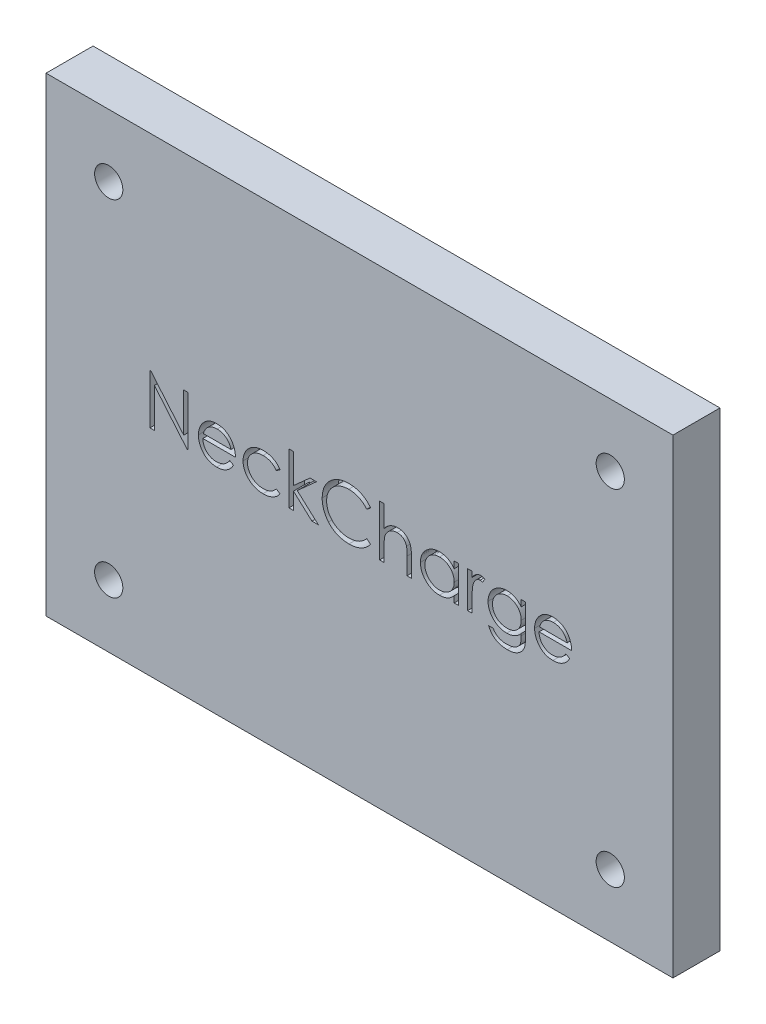
from build123d import *

# Parameters (mm, degrees)
SKETCH1_W           = 40
SKETCH1_H           = 30
SKETCH1_W_2         = 36
SKETCH1_H_2         = 26
EXTRUDE_THIN1_DEPTH = 1
SKETCH1_3_W         = 40
SKETCH1_3_H         = 30
SKETCH1_3_W_2       = 36
SKETCH1_3_H_2       = 26
BOSS_EXTRUDE1_DEPTH = 2
SKETCH2_R           = 0.9
CUT_EXTRUDE1_DEPTH  = 2
WRAP1_START         = -1
WRAP1_DEPTH         = 1


# Read off the part's stored shape, not the designer's step: Wrap1
with BuildPart() as part:
    # Sketch1 → Extrude-Thin1 (new body)
    # profile 1 of 2: a face of its own
    with BuildSketch(Plane.XY):
        with Locations((1.25, 0)):
            Rectangle(SKETCH1_W, SKETCH1_H)
        with Locations((1.25, 0)):
            Rectangle(SKETCH1_W_2, SKETCH1_H_2, mode=Mode.SUBTRACT)
    # profile 2 of 2: a face of its own
    with BuildSketch(Plane.XY):
        with Locations((1.25, 0)):
            Rectangle(SKETCH1_W, SKETCH1_H)
        with Locations((1.25, 0)):
            Rectangle(SKETCH1_W_2, SKETCH1_H_2, mode=Mode.SUBTRACT)
    extrude(amount=-EXTRUDE_THIN1_DEPTH)

    # Sketch1<3> → Boss-Extrude1 (add)
    # profile 1 of 2: a face of its own
    with BuildSketch(Plane.XY):
        with Locations((1.25, 0)):
            Rectangle(SKETCH1_3_W, SKETCH1_3_H)
        with Locations((1.25, 0)):
            Rectangle(SKETCH1_3_W_2, SKETCH1_3_H_2, mode=Mode.SUBTRACT)
    # profile 2 of 2: a face of its own
    with BuildSketch(Plane.XY):
        with Locations((1.25, 0)):
            Rectangle(SKETCH1_3_W_2, SKETCH1_3_H_2)
    extrude(amount=BOSS_EXTRUDE1_DEPTH)

    # Sketch2 → Cut-Extrude1 (cut)
    with BuildSketch(Plane(origin=(0, 0, 0), x_dir=(-1, 0, 0), z_dir=(0, 0, -1))):
        with Locations((-17.25, 11)):
            Circle(SKETCH2_R)
        with Locations((14.75, 11)):
            Circle(SKETCH2_R)
        with Locations((14.75, -11)):
            Circle(SKETCH2_R)
        with Locations((-17.25, -11)):
            Circle(SKETCH2_R)
    extrude(amount=-CUT_EXTRUDE1_DEPTH, mode=Mode.SUBTRACT)

    # Wrap1 outline → Wrap1 (cut)
    # profile 1 of 10: a face of its own
    with BuildSketch(Plane.XY.offset(2).offset(WRAP1_START)):
        with BuildLine():
            add(Edge.make_bspline(
                [(14.662320676, -0.641993919), (14.642148907, -0.677774655), (14.602902634, -0.747389798), (14.535410527, -0.843031557), (14.464660575, -0.929071985), (14.387459119, -1.003212457), (14.30611591, -1.067847642), (14.220179859, -1.124396955), (14.129203574, -1.172583041), (14.033182752, -1.213179977), (13.931311017, -1.244394304), (13.823341498, -1.266441704), (13.709067356, -1.280069955), (13.630739036, -1.281653047), (13.590630972, -1.28246367)],
                knots=[0, 0, 0, 0, 0.093369857, 0.181660766, 0.265874227, 0.346354784, 0.424599862, 0.501903184, 0.579992091, 0.658443431, 0.738672236, 0.821894148, 0.908800792, 1, 1, 1, 1], degree=3))
            Line((14.662320676, -0.641993919), (14.40918566, -0.509066234))
            add(Edge.make_bspline(
                [(13.555013985, -0.997527773), (13.583453955, -0.996976179), (13.63988431, -0.99588171), (13.723922802, -0.985239191), (13.806599373, -0.968030441), (13.887571837, -0.944544521), (13.965196818, -0.915899805), (14.037083853, -0.88133507), (14.10319662, -0.843099228), (14.16498844, -0.799366166), (14.224924269, -0.745837311), (14.284380668, -0.679039192), (14.348131632, -0.600038363), (14.388036477, -0.540579081), (14.40918566, -0.509066234)],
                knots=[0, 0, 0, 0, 0.082592263, 0.163878894, 0.24565874, 0.327725695, 0.408609961, 0.485749086, 0.559169056, 0.630268476, 0.705306028, 0.792064966, 0.889796437, 1, 1, 1, 1], degree=3))
            add(Edge.make_bspline(
                [(12.708474522, -0.142720081), (12.709871165, -0.173291216), (12.712617607, -0.233408121), (12.725422058, -0.321374474), (12.745604874, -0.405170292), (12.773970381, -0.484167051), (12.80832102, -0.559396524), (12.850399491, -0.630300657), (12.900600372, -0.696556494), (12.9565944, -0.758756683), (13.01892155, -0.814147516), (13.084492328, -0.863724485), (13.154245776, -0.905276705), (13.227631895, -0.939004176), (13.304532014, -0.965407763), (13.384970363, -0.983430714), (13.468788654, -0.995502161), (13.525925713, -0.996844429), (13.555013985, -0.997527773)],
                knots=[0, 0, 0, 0, 0.068384615, 0.134475588, 0.198391058, 0.260753477, 0.321829223, 0.383037238, 0.444653123, 0.507398011, 0.569825238, 0.630777641, 0.690928687, 0.750945133, 0.811049477, 0.872330853, 0.935004094, 1, 1, 1, 1], degree=3))
            Line((12.708474522, -0.142720081), (14.78443606, -0.142720081))
            add(Edge.make_bspline(
                [(14.531937062, 0.662478237), (14.552009356, 0.635079274), (14.592020337, 0.580463723), (14.642137349, 0.491408459), (14.685641557, 0.398235277), (14.720415029, 0.299438079), (14.748572291, 0.19618746), (14.768943834, 0.087745294), (14.780890559, -0.025856125), (14.783238877, -0.103259501), (14.78443606, -0.142720081)],
                knots=[0, 0, 0, 0, 0.11852184, 0.236254763, 0.356174434, 0.477249655, 0.601539871, 0.729618382, 0.862158266, 1, 1, 1, 1], degree=3))
            add(Edge.make_bspline(
                [(13.597627166, 1.119138894), (13.645204637, 1.117910578), (13.738540788, 1.115500903), (13.874641355, 1.0931613), (14.003420005, 1.057735054), (14.124825206, 1.007702687), (14.238869265, 0.943150808), (14.344810896, 0.863193566), (14.444461911, 0.77028573), (14.502436121, 0.698836247), (14.531937062, 0.662478237)],
                knots=[0, 0, 0, 0, 0.132040234, 0.259032841, 0.381879824, 0.502258444, 0.62275219, 0.744742632, 0.870108927, 1, 1, 1, 1], degree=3))
            add(Edge.make_bspline(
                [(12.690666028, 0.686646907), (12.719429426, 0.720999382), (12.776045071, 0.788616132), (12.871799764, 0.877460185), (12.975486371, 0.95188561), (13.085805489, 1.013577798), (13.204039291, 1.060453177), (13.328598433, 1.095385055), (13.460901215, 1.114959394), (13.551348094, 1.117724215), (13.597627166, 1.119138894)],
                knots=[0, 0, 0, 0, 0.128835254, 0.253589335, 0.374643257, 0.495340042, 0.616324775, 0.739759335, 0.86684232, 1, 1, 1, 1], degree=3))
            add(Edge.make_bspline(
                [(12.423538624, -0.088022564), (12.424499417, -0.05237654), (12.426403581, 0.018269174), (12.438405795, 0.122831489), (12.459676747, 0.2244573), (12.488865269, 0.323231049), (12.526558185, 0.418987356), (12.57267027, 0.5117845), (12.627273355, 0.601523734), (12.669430709, 0.658132291), (12.690666028, 0.686646907)],
                knots=[0, 0, 0, 0, 0.128044808, 0.2537679, 0.377428427, 0.500550841, 0.623295883, 0.746578332, 0.872347541, 1, 1, 1, 1], degree=3))
            add(Edge.make_bspline(
                [(13.590630972, -1.28246367), (13.546052178, -1.281423018), (13.459091866, -1.279393008), (13.332509381, -1.261891987), (13.21332948, -1.233342061), (13.101558864, -1.193459034), (12.997471249, -1.141364247), (12.900859759, -1.077901003), (12.811216332, -1.003395315), (12.731365799, -0.917201827), (12.659480277, -0.824961766), (12.596047569, -0.728844642), (12.543018328, -0.629092288), (12.499881317, -0.526339742), (12.465042618, -0.421234638), (12.440761394, -0.312820664), (12.426764409, -0.201391241), (12.424619519, -0.126010087), (12.423538624, -0.088022564)],
                knots=[0, 0, 0, 0, 0.071578658, 0.139629225, 0.204796697, 0.268134963, 0.329813747, 0.391301398, 0.453433515, 0.51655169, 0.579631271, 0.641118921, 0.701294047, 0.760810336, 0.819931722, 0.878919575, 0.938982822, 1, 1, 1, 1], degree=3))
        make_face()
        with BuildLine():
            add(Edge.make_bspline(
                [(13.612255572, 0.834202996), (13.583817152, 0.833648123), (13.527600376, 0.832551255), (13.444777265, 0.822146209), (13.365239252, 0.804946921), (13.288399455, 0.781392996), (13.215264811, 0.74999805), (13.144330985, 0.713183265), (13.077401626, 0.668241972), (13.035544879, 0.633989296), (13.014399001, 0.616684968)],
                knots=[0, 0, 0, 0, 0.131091976, 0.259141276, 0.384161763, 0.505991952, 0.629098089, 0.750669123, 0.874038938, 1, 1, 1, 1], degree=3))
            add(Edge.make_bspline(
                [(14.499500163, 0.142215817), (14.489071082, 0.180009995), (14.468998459, 0.252751622), (14.427055471, 0.353481573), (14.379819145, 0.443005598), (14.323919431, 0.52063855), (14.260583873, 0.589584594), (14.187427172, 0.649835739), (14.105388897, 0.703735856), (14.014893105, 0.749231337), (13.919060914, 0.787957138), (13.818725297, 0.813924207), (13.716347161, 0.831712863), (13.647101058, 0.833369405), (13.612255572, 0.834202996)],
                knots=[0, 0, 0, 0, 0.096240125, 0.185231261, 0.267500523, 0.344400382, 0.419594869, 0.496890627, 0.576637919, 0.660267852, 0.745386615, 0.830040327, 0.914474212, 1, 1, 1, 1], degree=3))
            Line((14.499500163, 0.142215817), (12.73836735, 0.142215817))
            add(Edge.make_bspline(
                [(13.014399001, 0.616684968), (12.99925581, 0.602992267), (12.968609681, 0.575281578), (12.927660779, 0.527539369), (12.888453636, 0.476057595), (12.852772394, 0.418866661), (12.820044869, 0.356617811), (12.789419747, 0.289836099), (12.76185493, 0.21801476), (12.746346316, 0.167965475), (12.73836735, 0.142215817)],
                knots=[0, 0, 0, 0, 0.109983845, 0.222580497, 0.338499871, 0.458708565, 0.585535346, 0.717517743, 0.85466682, 1, 1, 1, 1], degree=3))
        make_face(mode=Mode.SUBTRACT)
    # profile 2 of 10: a face of its own
    with BuildSketch(Plane.XY.offset(2).offset(WRAP1_START)):
        with BuildLine():
            add(Edge.make_bspline(
                [(11.853672014, -0.768387875), (11.853420697, -0.807610551), (11.852935594, -0.883319761), (11.849442213, -0.992792201), (11.842075598, -1.093907864), (11.833722009, -1.187127913), (11.821705345, -1.272020256), (11.807031069, -1.348838206), (11.790488703, -1.41765548), (11.775956077, -1.460041586), (11.769081669, -1.480091601)],
                knots=[0, 0, 0, 0, 0.163445255, 0.315488713, 0.456290824, 0.58586415, 0.705428686, 0.813370713, 0.911718238, 1, 1, 1, 1], degree=3))
            Line((11.853672014, -0.768387875), (11.853672014, 1.072883158))
            Line((11.853672014, 1.072883158), (11.568736116, 1.072883158))
            Line((11.568736116, 1.072883158), (11.568736116, 0.667103911))
            add(Edge.make_bspline(
                [(10.650326661, 1.113588286), (10.693008584, 1.11235759), (10.777292268, 1.109927343), (10.90132682, 1.090858161), (11.021017281, 1.060456163), (11.137039052, 1.016899127), (11.25033725, 0.957435878), (11.360538466, 0.879110489), (11.467961538, 0.781220395), (11.53425357, 0.706151725), (11.568736116, 0.667103911)],
                knots=[0, 0, 0, 0, 0.120911079, 0.238762229, 0.354754859, 0.470359399, 0.589144099, 0.716328905, 0.852445286, 1, 1, 1, 1], degree=3))
            add(Edge.make_bspline(
                [(9.45206945, -0.079580784), (9.452540408, -0.053270833), (9.4534805, -0.000752832), (9.461600317, 0.077152039), (9.473182888, 0.154013741), (9.491514222, 0.229040026), (9.513578224, 0.303085337), (9.540904608, 0.375602751), (9.573760197, 0.446614356), (9.610961898, 0.516172738), (9.652766754, 0.583344503), (9.698606933, 0.647140817), (9.748537776, 0.70709223), (9.801870442, 0.763803556), (9.859256133, 0.816727625), (9.920665162, 0.865735986), (9.985492203, 0.911650138), (10.053938173, 0.953479708), (10.124946947, 0.990475032), (10.196714482, 1.024232173), (10.270191452, 1.051023839), (10.34400797, 1.074630507), (10.419464035, 1.091353863), (10.495634457, 1.104255468), (10.572780006, 1.112115608), (10.624444418, 1.11309676), (10.650326661, 1.113588286)],
                knots=[0, 0, 0, 0, 0.042034119, 0.083905433, 0.125068934, 0.16615847, 0.207210273, 0.248490732, 0.289878112, 0.332169514, 0.374475842, 0.41622498, 0.457609587, 0.49907317, 0.540553362, 0.582248849, 0.62454975, 0.667432801, 0.710322543, 0.752467119, 0.794064757, 0.835215707, 0.876228344, 0.917446189, 0.95864314, 1, 1, 1, 1], degree=3))
            add(Edge.make_bspline(
                [(10.641422414, -1.247309149), (10.614900941, -1.246841947), (10.56217185, -1.245913071), (10.483835758, -1.23778618), (10.406655646, -1.225994463), (10.330811515, -1.208684872), (10.256193923, -1.186467378), (10.182926179, -1.158693622), (10.110415051, -1.127292764), (10.039978585, -1.090306007), (9.972318309, -1.049155914), (9.907944563, -1.004579921), (9.847194531, -0.956811331), (9.79064643, -0.905379107), (9.738374435, -0.850357688), (9.689675498, -0.792333607), (9.645354904, -0.730496635), (9.604503187, -0.665974323), (9.569072409, -0.598336914), (9.537971586, -0.52905107), (9.510930197, -0.45826494), (9.489371583, -0.385741533), (9.47290593, -0.311526571), (9.460650224, -0.235741636), (9.45369885, -0.158153355), (9.452614883, -0.10588256), (9.45206945, -0.079580784)],
                knots=[0, 0, 0, 0, 0.042864759, 0.085222258, 0.127202284, 0.169025313, 0.210882033, 0.252962678, 0.295628285, 0.338553294, 0.381463248, 0.423581562, 0.465066165, 0.506312219, 0.547039505, 0.587675833, 0.628674786, 0.669946465, 0.711035574, 0.751995829, 0.792672607, 0.833446018, 0.874190607, 0.915493583, 0.957477807, 1, 1, 1, 1], degree=3))
            add(Edge.make_bspline(
                [(11.568736116, -0.802732827), (11.539815388, -0.837151462), (11.482482639, -0.905383319), (11.383470421, -0.994792803), (11.275323648, -1.07179665), (11.158226434, -1.134950697), (11.0350471, -1.185461704), (10.907119791, -1.220788532), (10.775591284, -1.243612156), (10.686462548, -1.246068079), (10.641422414, -1.247309149)],
                knots=[0, 0, 0, 0, 0.126560713, 0.250895262, 0.374719265, 0.499826424, 0.624963531, 0.749039475, 0.87318012, 1, 1, 1, 1], degree=3))
            Line((11.568736116, -0.802732827), (11.568736116, -0.922940159))
            add(Edge.make_bspline(
                [(10.650326661, -1.857886073), (10.700008055, -1.856588723), (10.795788808, -1.854087564), (10.933521369, -1.833729333), (11.059246777, -1.799644861), (11.172240673, -1.751921539), (11.271169835, -1.693455813), (11.356452141, -1.62814146), (11.42552624, -1.554498693), (11.471983717, -1.486660912), (11.500862263, -1.426223308), (11.519252078, -1.374196311), (11.534196321, -1.315365486), (11.546696603, -1.249928068), (11.557011645, -1.177790565), (11.563545689, -1.098788035), (11.568268103, -1.013100026), (11.568576505, -0.953688393), (11.568736116, -0.922940159)],
                knots=[0, 0, 0, 0, 0.098171298, 0.189264436, 0.274463056, 0.355023171, 0.430920462, 0.501086045, 0.566607627, 0.629720863, 0.662710695, 0.698765562, 0.738610537, 0.782581228, 0.830408787, 0.882577866, 0.939228681, 1, 1, 1, 1], degree=3))
            add(Edge.make_bspline(
                [(9.777710475, -1.410129662), (9.800626908, -1.446511421), (9.845425712, -1.517633279), (9.929198977, -1.609720214), (10.021007573, -1.688417909), (10.123949857, -1.751836968), (10.23845416, -1.799652279), (10.364589368, -1.833738441), (10.503381882, -1.854145768), (10.600009119, -1.856605299), (10.650326661, -1.857886073)],
                knots=[0, 0, 0, 0, 0.124716487, 0.243805374, 0.360061534, 0.475112, 0.593525098, 0.71935017, 0.853854771, 1, 1, 1, 1], degree=3))
            Line((9.777710475, -1.410129662), (9.492774578, -1.410129662))
            add(Edge.make_bspline(
                [(10.677675419, -2.14282197), (10.62970141, -2.142045015), (10.535995281, -2.140527413), (10.399375037, -2.122846369), (10.269622113, -2.097850616), (10.148450999, -2.060017835), (10.036627411, -2.013719995), (9.934915038, -1.960566002), (9.844226962, -1.8996157), (9.762471916, -1.830218726), (9.688683473, -1.747701672), (9.619262289, -1.650457006), (9.552441291, -1.537003471), (9.51328117, -1.453734367), (9.492774578, -1.410129662)],
                knots=[0, 0, 0, 0, 0.096491424, 0.188473675, 0.276839915, 0.362136562, 0.443436755, 0.520165521, 0.592709664, 0.662917334, 0.7354188, 0.81488097, 0.903060556, 1, 1, 1, 1], degree=3))
            add(Edge.make_bspline(
                [(11.769081669, -1.480091601), (11.758931431, -1.506153745), (11.738934441, -1.55749879), (11.701482473, -1.630282781), (11.659541718, -1.698814149), (11.611638451, -1.762710979), (11.557989293, -1.821652507), (11.499858225, -1.876919278), (11.436113123, -1.927342058), (11.366790434, -1.972050864), (11.293488181, -2.012316263), (11.216248503, -2.047192792), (11.135506948, -2.077570143), (11.050505039, -2.100323822), (10.96257547, -2.120040318), (10.870684229, -2.132871569), (10.775368191, -2.141604686), (10.710557025, -2.142412254), (10.677675419, -2.14282197)],
                knots=[0, 0, 0, 0, 0.061370706, 0.120906468, 0.179423665, 0.237606687, 0.295938468, 0.354218227, 0.413537067, 0.474086783, 0.535121189, 0.596987665, 0.660019834, 0.724277496, 0.79001185, 0.857747684, 0.927829032, 1, 1, 1, 1], degree=3))
        make_face()
        with BuildLine():
            add(Edge.make_bspline(
                [(9.737005347, -0.091029101), (9.737663712, -0.121811427), (9.738958524, -0.18235126), (9.751407769, -0.271194922), (9.771529074, -0.355813492), (9.800047111, -0.436212089), (9.83538277, -0.512851867), (9.879825849, -0.585204887), (9.932123516, -0.653335585), (9.991866437, -0.716740046), (10.057703583, -0.774489639), (10.129113143, -0.825233433), (10.205998262, -0.866735873), (10.286468011, -0.902605061), (10.372474912, -0.928802501), (10.462780154, -0.948794822), (10.558022621, -0.960232767), (10.622948413, -0.961650448), (10.65605082, -0.962373252)],
                knots=[0, 0, 0, 0, 0.064983044, 0.127802645, 0.189056336, 0.248394647, 0.307690706, 0.366976619, 0.427340044, 0.488794715, 0.550673693, 0.612045111, 0.673369139, 0.734929754, 0.797809968, 0.862891673, 0.930095338, 1, 1, 1, 1], degree=3))
            add(Edge.make_bspline(
                [(10.673223296, 0.828652389), (10.631557586, 0.82723628), (10.549068315, 0.824432683), (10.428156747, 0.800497979), (10.311428386, 0.762991341), (10.201114891, 0.70934054), (10.09778487, 0.643940767), (10.006095568, 0.564710649), (9.92589968, 0.474226599), (9.858060872, 0.373306732), (9.804057418, 0.264429382), (9.765827316, 0.149666073), (9.741107652, 0.030871187), (9.738379282, -0.050202531), (9.737005347, -0.091029101)],
                knots=[0, 0, 0, 0, 0.085518899, 0.169309287, 0.252217903, 0.336756454, 0.420595494, 0.502741104, 0.584803551, 0.668268485, 0.75182313, 0.833628628, 0.916219799, 1, 1, 1, 1], degree=3))
            add(Edge.make_bspline(
                [(11.568736116, -0.074492643), (11.567520937, -0.03220359), (11.565146903, 0.05041436), (11.542743052, 0.170798356), (11.506620433, 0.283981368), (11.455959451, 0.389605431), (11.392475771, 0.48655138), (11.31601193, 0.573023725), (11.227886602, 0.649133787), (11.128352983, 0.712541434), (11.021267086, 0.76376365), (10.909215715, 0.802191829), (10.792365225, 0.8239581), (10.713165839, 0.82707862), (10.673223296, 0.828652389)],
                knots=[0, 0, 0, 0, 0.089242793, 0.174349058, 0.257613109, 0.339527367, 0.42099739, 0.501579059, 0.58254176, 0.666132658, 0.750049131, 0.83274294, 0.915647421, 1, 1, 1, 1], degree=3))
            add(Edge.make_bspline(
                [(10.65605082, -0.962373252), (10.689582229, -0.961676921), (10.755152545, -0.960315253), (10.850920465, -0.948609936), (10.941664451, -0.929721429), (11.027301297, -0.902903542), (11.108154342, -0.868684525), (11.183315314, -0.825380594), (11.254395806, -0.776064288), (11.319126264, -0.718540532), (11.3776589, -0.655144858), (11.428668238, -0.586161275), (11.472133488, -0.512627804), (11.508126803, -0.434552734), (11.535605253, -0.351329314), (11.554037402, -0.263165591), (11.566924949, -0.17048395), (11.568123217, -0.106976133), (11.568736116, -0.074492643)],
                knots=[0, 0, 0, 0, 0.070121499, 0.137121849, 0.201487121, 0.263765119, 0.324560095, 0.384738887, 0.444904604, 0.50523192, 0.565493995, 0.625099744, 0.684349714, 0.743882825, 0.804608206, 0.867238914, 0.932094288, 1, 1, 1, 1], degree=3))
        make_face(mode=Mode.SUBTRACT)
    # profile 3 of 10: a face of its own
    with BuildSketch(Plane.XY.offset(2).offset(WRAP1_START)):
        with BuildLine():
            add(Edge.make_bspline(
                [(8.434443517, 0.728908549), (8.455479034, 0.760709193), (8.495709297, 0.821527678), (8.562577454, 0.901963401), (8.631069762, 0.968561336), (8.70151411, 1.021632386), (8.774428529, 1.061377143), (8.848212764, 1.090490111), (8.924027654, 1.107705247), (8.974974543, 1.110003637), (9.000499206, 1.111155143)],
                knots=[0, 0, 0, 0, 0.160059412, 0.306112383, 0.438366514, 0.560541455, 0.675317225, 0.786113634, 0.892841788, 1, 1, 1, 1], degree=3))
            Line((8.434443517, 0.728908549), (8.434443517, 1.070450015))
            Line((8.434443517, 1.070450015), (8.14950762, 1.070450015))
            Line((8.14950762, 1.070450015), (8.14950762, -1.249742292))
            Line((8.14950762, -1.249742292), (8.434443517, -1.249742292))
            Line((8.434443517, -1.249742292), (8.434443517, -0.46998468))
            add(Edge.make_bspline(
                [(8.485324927, 0.32630939), (8.48103197, 0.307915097), (8.471523397, 0.267173135), (8.462278217, 0.198821259), (8.453143725, 0.118064083), (8.446706079, 0.024676817), (8.440738855, -0.081107329), (8.43737328, -0.199449508), (8.434558288, -0.330471191), (8.434482935, -0.422069354), (8.434443517, -0.46998468)],
                knots=[0, 0, 0, 0, 0.070854869, 0.15693815, 0.258600395, 0.37589093, 0.508166168, 0.656237809, 0.82017677, 1, 1, 1, 1], degree=3))
            add(Edge.make_bspline(
                [(8.946437708, 0.826219246), (8.923572507, 0.824695212), (8.876934124, 0.821586625), (8.8084589, 0.797149278), (8.742013221, 0.757665667), (8.689243213, 0.713876873), (8.648383455, 0.671651371), (8.619227679, 0.634777463), (8.592482615, 0.593431133), (8.566928201, 0.548319205), (8.543645206, 0.498671416), (8.521914899, 0.444983787), (8.502267216, 0.387194134), (8.49106378, 0.346932848), (8.485324927, 0.32630939)],
                knots=[0, 0, 0, 0, 0.093806529, 0.191338128, 0.295190617, 0.410312337, 0.471930251, 0.536425159, 0.603118728, 0.674117672, 0.749332023, 0.828283384, 0.912039809, 1, 1, 1, 1], degree=3))
            add(Edge.make_bspline(
                [(9.092085745, 0.7848781), (9.078379704, 0.790992484), (9.052363015, 0.802598756), (9.01430423, 0.816334723), (8.979214732, 0.824422732), (8.956859504, 0.825648026), (8.946437708, 0.826219246)],
                knots=[0, 0, 0, 0, 0.295138801, 0.560229945, 0.794983357, 1, 1, 1, 1], degree=3))
            Line((9.092085745, 0.7848781), (9.248546081, 1.03165294))
            add(Edge.make_bspline(
                [(9.000499206, 1.111155143), (9.020298802, 1.110075166), (9.061037758, 1.107853041), (9.122707679, 1.092240365), (9.186247096, 1.067313873), (9.22719769, 1.0438731), (9.248546081, 1.03165294)],
                knots=[0, 0, 0, 0, 0.225277548, 0.463523195, 0.720323555, 1, 1, 1, 1], degree=3))
        make_face()
    # profile 4 of 10: a face of its own
    with BuildSketch(Plane.XY.offset(2).offset(WRAP1_START)):
        with BuildLine():
            add(Edge.make_bspline(
                [(7.294705183, -0.854041812), (7.26257528, -0.890363444), (7.19987337, -0.961245565), (7.095151784, -1.053848678), (6.984146366, -1.13039187), (6.867395882, -1.192213579), (6.745005761, -1.238652088), (6.61724731, -1.271659532), (6.484068415, -1.292881082), (6.393125207, -1.295000188), (6.347038916, -1.296074064)],
                knots=[0, 0, 0, 0, 0.134298379, 0.262084975, 0.386269912, 0.507164597, 0.627300236, 0.748144942, 0.872370177, 1, 1, 1, 1], degree=3))
            Line((7.294705183, -0.854041812), (7.294705183, -1.255368936))
            Line((7.294705183, -1.255368936), (7.57964108, -1.255368936))
            Line((7.57964108, -1.255368936), (7.57964108, 1.064823372))
            Line((7.57964108, 1.064823372), (7.294705183, 1.064823372))
            Line((7.294705183, 1.064823372), (7.294705183, 0.635511473))
            add(Edge.make_bspline(
                [(6.355943163, 1.1055285), (6.403295893, 1.104224254), (6.49615236, 1.101666689), (6.631977054, 1.080382644), (6.76046883, 1.044424892), (6.882619564, 0.995514018), (6.997990615, 0.930518385), (7.105489751, 0.848530849), (7.206242011, 0.750068487), (7.264644132, 0.674439584), (7.294705183, 0.635511473)],
                knots=[0, 0, 0, 0, 0.129862142, 0.254653531, 0.376014554, 0.495255252, 0.614797719, 0.738105554, 0.8651963, 1, 1, 1, 1], degree=3))
            add(Edge.make_bspline(
                [(5.137333388, -0.088912605), (5.138470012, -0.048577674), (5.140717056, 0.031162309), (5.157456763, 0.148436556), (5.185606321, 0.261392407), (5.225110439, 0.369666205), (5.27576707, 0.473388965), (5.337387549, 0.572634045), (5.409976326, 0.667674855), (5.493662438, 0.756276611), (5.584317551, 0.838119597), (5.681299043, 0.909247803), (5.782194448, 0.970676658), (5.888568751, 1.019348026), (5.998847481, 1.058726285), (6.114012393, 1.085970478), (6.233584325, 1.102024476), (6.314764986, 1.104349269), (6.355943163, 1.1055285)],
                knots=[0, 0, 0, 0, 0.063774532, 0.12607881, 0.186904093, 0.247573935, 0.308003356, 0.369131898, 0.432033228, 0.496790794, 0.561610823, 0.624913866, 0.686726349, 0.748078833, 0.809582291, 0.871630743, 0.934885821, 1, 1, 1, 1], degree=3))
            add(Edge.make_bspline(
                [(6.347038916, -1.296074064), (6.30606513, -1.294961569), (6.225263008, -1.29276768), (6.106400917, -1.27574759), (5.992017233, -1.248414812), (5.882003871, -1.210404719), (5.777072711, -1.159984974), (5.676325337, -1.099622556), (5.580283681, -1.027739803), (5.490411642, -0.94556352), (5.407651184, -0.85630521), (5.335024173, -0.761104607), (5.274469593, -0.660373374), (5.223832806, -0.555386871), (5.184828979, -0.445336908), (5.157638611, -0.330604048), (5.140638348, -0.211323949), (5.138445366, -0.13009881), (5.137333388, -0.088912605)],
                knots=[0, 0, 0, 0, 0.064619991, 0.127433484, 0.189004127, 0.249930071, 0.310668454, 0.372328961, 0.43493911, 0.499575544, 0.564191208, 0.626735217, 0.688109334, 0.749293607, 0.810330528, 0.87190117, 0.935045915, 1, 1, 1, 1], degree=3))
        make_face()
        with BuildLine():
            add(Edge.make_bspline(
                [(5.422269285, -0.092092694), (5.42396101, -0.131635148), (5.427337828, -0.210565064), (5.451604529, -0.327568873), (5.492316986, -0.441555039), (5.547872286, -0.551556083), (5.61743801, -0.653685946), (5.698072716, -0.745978771), (5.790556185, -0.825344326), (5.892997567, -0.891781268), (6.002406226, -0.945450126), (6.117462721, -0.982793242), (6.236004192, -1.006903086), (6.316605952, -1.00971929), (6.357215199, -1.011138166)],
                knots=[0, 0, 0, 0, 0.081589349, 0.162858895, 0.245483689, 0.330807139, 0.416493374, 0.499893203, 0.583048156, 0.667157852, 0.751311929, 0.833784789, 0.916256489, 1, 1, 1, 1], degree=3))
            add(Edge.make_bspline(
                [(6.359759269, 0.820592603), (6.318108405, 0.81911066), (6.235896225, 0.816185541), (6.115206309, 0.793349584), (5.999714855, 0.755354274), (5.889999488, 0.703391406), (5.78779332, 0.638051052), (5.696449776, 0.559019512), (5.615221754, 0.468453078), (5.5469064, 0.366760449), (5.491216449, 0.257741752), (5.452057784, 0.14378244), (5.42623211, 0.026937925), (5.423593666, -0.052312512), (5.422269285, -0.092092694)],
                knots=[0, 0, 0, 0, 0.085920517, 0.169593435, 0.252475515, 0.336244477, 0.419504521, 0.502035907, 0.584774648, 0.669846475, 0.754184866, 0.836658238, 0.918009726, 1, 1, 1, 1], degree=3))
            add(Edge.make_bspline(
                [(7.294705183, -0.100360923), (7.293834637, -0.068304462), (7.292121128, -0.005207203), (7.27903054, 0.087437045), (7.258207143, 0.176095496), (7.228864546, 0.260861364), (7.19031888, 0.341265985), (7.143829836, 0.417886682), (7.088579892, 0.490324952), (7.025458446, 0.55758331), (6.956365727, 0.618930172), (6.883254965, 0.673689162), (6.805259959, 0.718673262), (6.723692361, 0.755903559), (6.63841065, 0.785530073), (6.548720874, 0.805294624), (6.455576364, 0.818865772), (6.392034585, 0.820010932), (6.359759269, 0.820592603)],
                knots=[0, 0, 0, 0, 0.0656338, 0.129188088, 0.191218683, 0.251912818, 0.312507474, 0.373494434, 0.4351516, 0.498741474, 0.562095217, 0.624186567, 0.685475718, 0.746096815, 0.807611636, 0.869966581, 0.933951019, 1, 1, 1, 1], degree=3))
            add(Edge.make_bspline(
                [(6.357215199, -1.011138166), (6.398441669, -1.009632342), (6.48043703, -1.006637407), (6.601485, -0.983703687), (6.718955431, -0.94581342), (6.831248131, -0.893290641), (6.935856336, -0.828196468), (7.029743696, -0.751990036), (7.109133182, -0.66335929), (7.176436477, -0.565953508), (7.229209891, -0.459171911), (7.26765103, -0.345475895), (7.290378502, -0.224861502), (7.293243014, -0.14243494), (7.294705183, -0.100360923)],
                knots=[0, 0, 0, 0, 0.084802388, 0.16866354, 0.252551924, 0.338239689, 0.423102661, 0.505556051, 0.586175656, 0.66713572, 0.74849918, 0.830452399, 0.913455706, 1, 1, 1, 1], degree=3))
        make_face(mode=Mode.SUBTRACT)
    # profile 5 of 10: a face of its own
    with BuildSketch(Plane.XY.offset(2).offset(WRAP1_START)):
        with BuildLine():
            add(Edge.make_bspline(
                [(2.817145767, 0.621588869), (2.847732176, 0.659819481), (2.907285483, 0.734256442), (3.007521246, 0.831376237), (3.110455537, 0.915557843), (3.219643614, 0.982568901), (3.333082301, 1.035506622), (3.451250035, 1.07305113), (3.574168773, 1.096138911), (3.657648731, 1.099040333), (3.699938235, 1.100510143)],
                knots=[0, 0, 0, 0, 0.140723513, 0.273995891, 0.40068416, 0.522554679, 0.641533771, 0.759969143, 0.878404515, 1, 1, 1, 1], degree=3))
            Line((2.817145767, 0.621588869), (2.817145767, 1.996022963))
            Line((2.817145767, 1.996022963), (2.53220987, 1.996022963))
            Line((2.53220987, 1.996022963), (2.53220987, -1.260387293))
            Line((2.53220987, -1.260387293), (2.817145767, -1.260387293))
            Line((2.817145767, -1.260387293), (2.817145767, -0.421480041))
            add(Edge.make_bspline(
                [(2.861030983, 0.201181217), (2.85745736, 0.185740783), (2.849669995, 0.152094176), (2.841220111, 0.096600325), (2.833656538, 0.032114831), (2.827262496, -0.0412645), (2.823340839, -0.123806555), (2.81911515, -0.214948068), (2.817542151, -0.315259944), (2.817281844, -0.385015154), (2.817145767, -0.421480041)],
                knots=[0, 0, 0, 0, 0.075999078, 0.165611346, 0.269045027, 0.387447975, 0.518826658, 0.665393555, 0.825082798, 1, 1, 1, 1], degree=3))
            add(Edge.make_bspline(
                [(3.649692842, 0.815574245), (3.626771362, 0.815142603), (3.581410346, 0.814288394), (3.514146913, 0.805712357), (3.448896977, 0.791698163), (3.385032144, 0.77273476), (3.323905958, 0.746930594), (3.263736692, 0.717058208), (3.206229088, 0.680492863), (3.150361954, 0.639466631), (3.098366763, 0.594046206), (3.049991451, 0.546106468), (3.006867385, 0.495057036), (2.967798021, 0.441716931), (2.934072004, 0.385354518), (2.904632423, 0.326513315), (2.879653612, 0.26511594), (2.867241456, 0.222502849), (2.861030983, 0.201181217)],
                knots=[0, 0, 0, 0, 0.064019975, 0.126693877, 0.189084395, 0.250362632, 0.312516479, 0.374242602, 0.437850162, 0.502657326, 0.567745439, 0.630575914, 0.69277209, 0.754267546, 0.815120554, 0.876051359, 0.937981798, 1, 1, 1, 1], degree=3))
            add(Edge.make_bspline(
                [(4.249457466, 0.358913588), (4.239094043, 0.394921956), (4.219170424, 0.464147833), (4.172862616, 0.558184448), (4.115024085, 0.638362035), (4.044405498, 0.703598567), (3.962256125, 0.754771892), (3.8680403, 0.790211952), (3.762644752, 0.8122081), (3.688393774, 0.814420896), (3.649692842, 0.815574245)],
                knots=[0, 0, 0, 0, 0.136257396, 0.26195405, 0.379637675, 0.494379033, 0.609866212, 0.729887486, 0.859212548, 1, 1, 1, 1], degree=3))
            add(Edge.make_bspline(
                [(4.282530382, -0.168981043), (4.28235775, -0.137391907), (4.282027534, -0.076967266), (4.280935929, 0.009543418), (4.278499148, 0.088007769), (4.274561399, 0.158174318), (4.270420013, 0.220140886), (4.264720146, 0.273817486), (4.25808872, 0.319277839), (4.252129897, 0.346641466), (4.249457466, 0.358913588)],
                knots=[0, 0, 0, 0, 0.17886657, 0.342141307, 0.489870991, 0.623312103, 0.740055623, 0.841468004, 0.928901093, 1, 1, 1, 1], degree=3))
            Line((4.282530382, -0.168981043), (4.282530382, -1.260387293))
            Line((4.282530382, -1.260387293), (4.56746628, -1.260387293))
            Line((4.56746628, -1.260387293), (4.56746628, -0.075486452))
            add(Edge.make_bspline(
                [(3.699938235, 1.100510143), (3.742873663, 1.098926788), (3.826908651, 1.095827781), (3.949265407, 1.071322786), (4.063529915, 1.029451396), (4.169362501, 0.97214988), (4.264453476, 0.900782387), (4.348681477, 0.81838522), (4.417479915, 0.722886737), (4.464287686, 0.634661421), (4.494743563, 0.556158408), (4.514022005, 0.488815286), (4.530367992, 0.413774694), (4.544609896, 0.331075258), (4.554101859, 0.240319995), (4.561726048, 0.14191835), (4.567147546, 0.035875964), (4.567357644, -0.037530262), (4.56746628, -0.075486452)],
                knots=[0, 0, 0, 0, 0.077228553, 0.151154907, 0.223453638, 0.295497225, 0.366919857, 0.436794085, 0.506696431, 0.577863847, 0.61591181, 0.658048026, 0.703775986, 0.754080143, 0.808979421, 0.867913193, 0.931701816, 1, 1, 1, 1], degree=3))
        make_face()
    # profile 6 of 10: a face of its own
    with BuildSketch(Plane.XY.offset(2).offset(WRAP1_START)):
        with BuildLine():
            add(Edge.make_bspline(
                [(1.713025414, 1.134524128), (1.695240072, 1.155720401), (1.659909174, 1.197827174), (1.603068326, 1.256954332), (1.543830407, 1.312349248), (1.482218062, 1.36427581), (1.417122289, 1.410918162), (1.350119993, 1.454706948), (1.280090338, 1.493956968), (1.183251264, 1.541548391), (1.056570716, 1.591210974), (0.897099683, 1.632851763), (0.730628901, 1.659359544), (0.617056793, 1.662230507), (0.559289436, 1.663690795)],
                knots=[0, 0, 0, 0, 0.063163259, 0.125474941, 0.18712122, 0.248294346, 0.309294856, 0.369850066, 0.430973376, 0.49245599, 0.616147966, 0.740843698, 0.868182649, 1, 1, 1, 1], degree=3))
            Line((1.713025414, 1.134524128), (1.962344324, 1.325329416))
            add(Edge.make_bspline(
                [(0.57709793, 1.98933182), (0.613578201, 1.988894452), (0.685787223, 1.988028726), (0.792605701, 1.979586725), (0.896602669, 1.965513668), (0.997849774, 1.946358376), (1.096839576, 1.922584592), (1.192815509, 1.891614464), (1.286340746, 1.856202754), (1.376825441, 1.815419002), (1.463835455, 1.769638458), (1.547343687, 1.719368571), (1.626686808, 1.664671662), (1.702423121, 1.606012924), (1.773285684, 1.542151374), (1.841286454, 1.474843555), (1.904116146, 1.402150729), (1.942899401, 1.350983396), (1.962344324, 1.325329416)],
                knots=[0, 0, 0, 0, 0.068547537, 0.135682946, 0.20121499, 0.265682235, 0.329266835, 0.392395428, 0.455069762, 0.51712685, 0.578790035, 0.639739863, 0.700191504, 0.759806243, 0.819628319, 0.879354791, 0.939511608, 1, 1, 1, 1], degree=3))
            add(Edge.make_bspline(
                [(-1.131245419, 0.338866075), (-1.129834637, 0.395975665), (-1.12705901, 0.508335218), (-1.10347711, 0.673230161), (-1.065541487, 0.831210359), (-1.011660024, 0.981980899), (-0.943347313, 1.126334796), (-0.858958884, 1.263169317), (-0.75947512, 1.393359557), (-0.645676255, 1.514930081), (-0.520883029, 1.62609078), (-0.387243819, 1.723886407), (-0.245020196, 1.805273011), (-0.095779002, 1.873305244), (0.061597295, 1.925597007), (0.226772923, 1.962203112), (0.39943751, 1.984987925), (0.517241281, 1.987868292), (0.57709793, 1.98933182)],
                knots=[0, 0, 0, 0, 0.064557846, 0.127013532, 0.18795481, 0.248013913, 0.307747682, 0.368234515, 0.429469844, 0.492743437, 0.556257769, 0.618216786, 0.679655476, 0.741245546, 0.803415265, 0.866815462, 0.932328312, 1, 1, 1, 1], degree=3))
            add(Edge.make_bspline(
                [(-0.728646261, -0.793245303), (-0.760791452, -0.753747225), (-0.824693749, -0.675227923), (-0.906450619, -0.547968497), (-0.976434472, -0.415100908), (-1.033018343, -0.275927115), (-1.077253108, -0.130759414), (-1.107897478, 0.020475374), (-1.127810719, 0.177636007), (-1.13008791, 0.284530809), (-1.131245419, 0.338866075)],
                knots=[0, 0, 0, 0, 0.12432851, 0.247156016, 0.368779749, 0.490733862, 0.613613772, 0.738957576, 0.867310575, 1, 1, 1, 1], degree=3))
            add(Edge.make_bspline(
                [(0.580914036, -1.348488693), (0.546765852, -1.348251028), (0.479242047, -1.347781075), (0.37954818, -1.340168181), (0.282493346, -1.329781634), (0.188354935, -1.314142372), (0.096619229, -1.295687149), (0.008117842, -1.270948223), (-0.078020099, -1.243235765), (-0.161448522, -1.210664813), (-0.242238393, -1.173910847), (-0.320129136, -1.132371362), (-0.395084928, -1.08639567), (-0.467842703, -1.036997197), (-0.537327654, -0.982589216), (-0.604141923, -0.92392734), (-0.668660169, -0.861209287), (-0.708576891, -0.815983813), (-0.728646261, -0.793245303)],
                knots=[0, 0, 0, 0, 0.069662801, 0.137749562, 0.203916744, 0.268779862, 0.332413706, 0.39475354, 0.456180032, 0.516995649, 0.577395938, 0.637198344, 0.696999184, 0.756756194, 0.816553905, 0.876947997, 0.938131788, 1, 1, 1, 1], degree=3))
            add(Edge.make_bspline(
                [(1.962344324, -0.682578236), (1.942280039, -0.708466689), (1.902247575, -0.76011959), (1.837424945, -0.832937498), (1.769137682, -0.901430445), (1.696878574, -0.965046215), (1.621478863, -1.025057766), (1.541584694, -1.079760142), (1.458246357, -1.129916873), (1.371746223, -1.175842725), (1.282176196, -1.216589085), (1.189643601, -1.251472146), (1.094547293, -1.281521153), (0.996882925, -1.306242553), (0.896447917, -1.325538465), (0.793604701, -1.338437741), (0.688131314, -1.347275049), (0.61697374, -1.348080516), (0.580914036, -1.348488693)],
                knots=[0, 0, 0, 0, 0.061674239, 0.123053062, 0.183475001, 0.243726501, 0.304278917, 0.364862921, 0.425946204, 0.48739123, 0.549220384, 0.611143589, 0.67352853, 0.736961457, 0.800785283, 0.866012596, 0.932100748, 1, 1, 1, 1], degree=3))
            Line((1.962344324, -0.682578236), (1.713025414, -0.493681))
            add(Edge.make_bspline(
                [(0.579005983, -1.022847667), (0.634434851, -1.021315702), (0.743532122, -1.01830043), (0.903523118, -0.992755968), (1.056681276, -0.951337714), (1.203014837, -0.89337317), (1.342111266, -0.818021088), (1.474188237, -0.726673727), (1.599357233, -0.618462168), (1.674624039, -0.535836759), (1.713025414, -0.493681)],
                knots=[0, 0, 0, 0, 0.12851519, 0.252948636, 0.374754734, 0.495939754, 0.617180641, 0.740909469, 0.867811148, 1, 1, 1, 1], degree=3))
            add(Edge.make_bspline(
                [(-0.846309522, 0.317241476), (-0.845164872, 0.270313778), (-0.842917503, 0.178177469), (-0.822916514, 0.043221273), (-0.79252261, -0.086065339), (-0.746969908, -0.208874196), (-0.690800484, -0.326719635), (-0.619825072, -0.437607737), (-0.537622927, -0.543214192), (-0.443031133, -0.641043152), (-0.339248714, -0.730409174), (-0.227898823, -0.809104345), (-0.10925879, -0.874704274), (0.015361439, -0.929292454), (0.146920842, -0.971253914), (0.285182841, -1.000794226), (0.429846723, -1.020063918), (0.528697536, -1.021908764), (0.579005983, -1.022847667)],
                knots=[0, 0, 0, 0, 0.064323217, 0.126290104, 0.186726469, 0.246146432, 0.305575643, 0.365429386, 0.426326309, 0.488839906, 0.551724972, 0.613918596, 0.675483766, 0.737333897, 0.800229044, 0.864502298, 0.931040739, 1, 1, 1, 1], degree=3))
            add(Edge.make_bspline(
                [(0.559289436, 1.663690795), (0.527463872, 1.663324343), (0.464108114, 1.662594841), (0.370084142, 1.652970848), (0.277815874, 1.639444251), (0.18736333, 1.619373422), (0.098841646, 1.59399826), (0.01167211, 1.563676635), (-0.07288322, 1.526161887), (-0.15599405, 1.484697966), (-0.235622335, 1.437864498), (-0.310965128, 1.386780243), (-0.381747642, 1.332016848), (-0.448025868, 1.273369059), (-0.509867564, 1.211100995), (-0.566824625, 1.144549056), (-0.618699961, 1.073926013), (-0.666521834, 1.000163136), (-0.709350528, 0.923475283), (-0.745209776, 0.843578611), (-0.776964422, 0.761841318), (-0.802091592, 0.677339908), (-0.821980261, 0.59066897), (-0.835703213, 0.501595898), (-0.845217755, 0.410306775), (-0.845943629, 0.348431184), (-0.846309522, 0.317241476)],
                knots=[0, 0, 0, 0, 0.043954909, 0.087501875, 0.130462627, 0.172752021, 0.215403067, 0.25764983, 0.300152749, 0.34312149, 0.385925163, 0.427685727, 0.46881795, 0.5094918, 0.549883031, 0.589980023, 0.63040523, 0.670868626, 0.711383944, 0.751627258, 0.791775577, 0.832458919, 0.873319045, 0.914542956, 0.956923558, 1, 1, 1, 1], degree=3))
        make_face()
    # profile 7 of 10: a face of its own
    with BuildSketch(Plane.XY.offset(2).offset(WRAP1_START)):
        with BuildLine():
            add(Edge.make_bspline(
                [(-4.056281686, 0.392403391), (-4.082434492, 0.424904863), (-4.133911851, 0.488878491), (-4.223301016, 0.571437502), (-4.31856137, 0.642346176), (-4.421320742, 0.700134579), (-4.531435003, 0.744785466), (-4.648469904, 0.776381438), (-4.772408755, 0.796070287), (-4.857376471, 0.79830806), (-4.900913096, 0.799454673)],
                knots=[0, 0, 0, 0, 0.128324238, 0.252584475, 0.373506483, 0.493364451, 0.614608597, 0.738470244, 0.865994718, 1, 1, 1, 1], degree=3))
            Line((-4.056281686, 0.392403391), (-3.817775075, 0.540595499))
            add(Edge.make_bspline(
                [(-4.879924514, 1.084390571), (-4.841933273, 1.083554284), (-4.76614069, 1.08188589), (-4.653708763, 1.067844541), (-4.542932837, 1.046675078), (-4.435756536, 1.015312582), (-4.333479341, 0.977336266), (-4.237743611, 0.934689018), (-4.150802945, 0.885163914), (-4.071040061, 0.830989238), (-3.998305784, 0.769883274), (-3.931853495, 0.701115534), (-3.870320499, 0.625043914), (-3.835434767, 0.568977286), (-3.817775075, 0.540595499)],
                knots=[0, 0, 0, 0, 0.091268804, 0.182081405, 0.271909655, 0.362049459, 0.450066348, 0.533976474, 0.613602454, 0.690197614, 0.765412877, 0.841436551, 0.919732749, 1, 1, 1, 1], degree=3))
            add(Edge.make_bspline(
                [(-6.178672511, -0.13549124), (-6.178272446, -0.108115089), (-6.177476652, -0.053659405), (-6.168349046, 0.027162548), (-6.156557574, 0.106908157), (-6.136577084, 0.184566588), (-6.113498797, 0.261315673), (-6.08403885, 0.336230343), (-6.049480884, 0.409658725), (-6.010245189, 0.481411665), (-5.966077542, 0.550308748), (-5.917199566, 0.615399572), (-5.865452204, 0.677466074), (-5.808414588, 0.734365485), (-5.748507188, 0.788373316), (-5.684035116, 0.838046757), (-5.615368164, 0.883531799), (-5.543537579, 0.925669506), (-5.468585162, 0.963188422), (-5.390963968, 0.995512859), (-5.311141721, 1.023137696), (-5.228990733, 1.04500793), (-5.145056276, 1.063348021), (-5.058676919, 1.074884924), (-4.970183117, 1.083036757), (-4.910260868, 1.083935548), (-4.879924514, 1.084390571)],
                knots=[0, 0, 0, 0, 0.041291447, 0.082135503, 0.122636035, 0.16283087, 0.203006601, 0.243526083, 0.284172936, 0.325409811, 0.366854666, 0.407550595, 0.448187374, 0.488682851, 0.529014965, 0.569842729, 0.611370238, 0.653237735, 0.695446119, 0.737751395, 0.780043361, 0.82280707, 0.865978142, 0.90959503, 0.954231405, 1, 1, 1, 1], degree=3))
            add(Edge.make_bspline(
                [(-4.903457166, -1.317211993), (-4.948461325, -1.316403475), (-5.036669803, -1.314818774), (-5.165776649, -1.297393943), (-5.289160476, -1.271125248), (-5.406779129, -1.233421004), (-5.51865092, -1.184884529), (-5.624671535, -1.125596471), (-5.724489923, -1.05506449), (-5.81711899, -0.974543978), (-5.902192159, -0.887239968), (-5.975240917, -0.793033256), (-6.038600556, -0.695387449), (-6.08947997, -0.59214595), (-6.12998111, -0.484680933), (-6.157653351, -0.372131502), (-6.175551042, -0.255425528), (-6.177622393, -0.175839271), (-6.178672511, -0.13549124)],
                knots=[0, 0, 0, 0, 0.069558544, 0.136335251, 0.201095766, 0.264449955, 0.327004991, 0.389391387, 0.45197649, 0.515669983, 0.578973246, 0.640167029, 0.699739843, 0.758684985, 0.817820401, 0.876983987, 0.937634285, 1, 1, 1, 1], degree=3))
            add(Edge.make_bspline(
                [(-3.817775075, -0.78168515), (-3.831915348, -0.80245031), (-3.86014896, -0.843911707), (-3.907345449, -0.902371727), (-3.958254153, -0.95709211), (-4.012676462, -1.007999507), (-4.069901764, -1.056312138), (-4.131884939, -1.099720352), (-4.196627373, -1.140664084), (-4.264889109, -1.177505761), (-4.335964385, -1.21062221), (-4.409753189, -1.239098486), (-4.485934877, -1.263564225), (-4.564599018, -1.283010961), (-4.645900697, -1.298532936), (-4.729629651, -1.308832366), (-4.815757043, -1.316520656), (-4.873970352, -1.31697955), (-4.903457166, -1.317211993)],
                knots=[0, 0, 0, 0, 0.059633396, 0.119068862, 0.178196546, 0.236956648, 0.295931988, 0.355855769, 0.416473305, 0.4777416, 0.53990299, 0.602537515, 0.665422385, 0.729765256, 0.794828771, 0.86182654, 0.930010932, 1, 1, 1, 1], degree=3))
            Line((-3.817775075, -0.78168515), (-4.056281686, -0.625224814))
            add(Edge.make_bspline(
                [(-4.899005043, -1.032276096), (-4.856954269, -1.031097266), (-4.774313338, -1.028780553), (-4.653511587, -1.009250708), (-4.538504096, -0.977279698), (-4.429294954, -0.932695758), (-4.326083718, -0.875067226), (-4.229537252, -0.803984264), (-4.137734451, -0.721491776), (-4.083762193, -0.657703331), (-4.056281686, -0.625224814)],
                knots=[0, 0, 0, 0, 0.129981079, 0.255447312, 0.377298345, 0.498441779, 0.619372125, 0.741856502, 0.868563689, 1, 1, 1, 1], degree=3))
            add(Edge.make_bspline(
                [(-5.893736613, -0.110050535), (-5.892122578, -0.150662605), (-5.888916253, -0.231339533), (-5.863787072, -0.350427525), (-5.822653217, -0.465565444), (-5.766357881, -0.575935826), (-5.695167909, -0.678074809), (-5.611554227, -0.769681229), (-5.515470487, -0.848980054), (-5.407763301, -0.914722988), (-5.290961634, -0.967574371), (-5.166329182, -1.005227452), (-5.034884381, -1.027953533), (-4.944889689, -1.030816424), (-4.899005043, -1.032276096)],
                knots=[0, 0, 0, 0, 0.080525242, 0.159965477, 0.240321361, 0.322528528, 0.405023583, 0.486596636, 0.567865474, 0.651332773, 0.736237567, 0.821529069, 0.909004906, 1, 1, 1, 1], degree=3))
            add(Edge.make_bspline(
                [(-4.900913096, 0.799454673), (-4.93571015, 0.798495966), (-5.004242001, 0.796607819), (-5.104849726, 0.784805443), (-5.200682432, 0.763358764), (-5.292340789, 0.735100396), (-5.379172883, 0.697226919), (-5.461406216, 0.651135212), (-5.539770197, 0.597568389), (-5.611993955, 0.535510252), (-5.678060268, 0.468020032), (-5.735299997, 0.395672037), (-5.785135644, 0.320633278), (-5.824238904, 0.241029912), (-5.856238523, 0.158683064), (-5.877290334, 0.072038352), (-5.891319022, -0.017794198), (-5.892924056, -0.079042977), (-5.893736613, -0.110050535)],
                knots=[0, 0, 0, 0, 0.069521641, 0.136920982, 0.201969243, 0.26546155, 0.328247885, 0.390816717, 0.453550176, 0.517541982, 0.580738372, 0.641921509, 0.701596724, 0.76031288, 0.818756513, 0.87771808, 0.938094053, 1, 1, 1, 1], degree=3))
        make_face()
    # profile 8 of 10: a face of its own
    with BuildSketch(Plane.XY.offset(2).offset(WRAP1_START)):
        with BuildLine():
            add(Edge.make_bspline(
                [(-6.789244463, -0.682064742), (-6.809416231, -0.717845478), (-6.848662505, -0.787460622), (-6.916154612, -0.883102381), (-6.986904563, -0.969142809), (-7.06410602, -1.043283281), (-7.145449229, -1.107918466), (-7.23138528, -1.164467778), (-7.322361565, -1.212653864), (-7.418382386, -1.2532508), (-7.520254122, -1.284465127), (-7.628223641, -1.306512528), (-7.742497783, -1.320140778), (-7.820826103, -1.32172387), (-7.860934166, -1.322534494)],
                knots=[0, 0, 0, 0, 0.093369857, 0.181660766, 0.265874227, 0.346354784, 0.424599862, 0.501903184, 0.579992091, 0.658443431, 0.738672236, 0.821894148, 0.908800792, 1, 1, 1, 1], degree=3))
            Line((-6.789244463, -0.682064742), (-7.042379479, -0.549137058))
            add(Edge.make_bspline(
                [(-7.896551154, -1.037598596), (-7.868111184, -1.037047002), (-7.811680829, -1.035952533), (-7.727642337, -1.025310014), (-7.644965765, -1.008101264), (-7.563993302, -0.984615344), (-7.48636832, -0.955970629), (-7.414481286, -0.921405893), (-7.348368519, -0.883170052), (-7.286576699, -0.839436989), (-7.226640869, -0.785908134), (-7.167184471, -0.719110016), (-7.103433507, -0.640109187), (-7.063528662, -0.580649904), (-7.042379479, -0.549137058)],
                knots=[0, 0, 0, 0, 0.082592263, 0.163878894, 0.24565874, 0.327725695, 0.408609961, 0.485749086, 0.559169056, 0.630268476, 0.705306028, 0.792064966, 0.889796437, 1, 1, 1, 1], degree=3))
            add(Edge.make_bspline(
                [(-8.743090617, -0.182790904), (-8.741693974, -0.213362039), (-8.738947532, -0.273478944), (-8.72614308, -0.361445297), (-8.705960264, -0.445241115), (-8.677594757, -0.524237874), (-8.643244119, -0.599467347), (-8.601165647, -0.670371481), (-8.550964766, -0.736627317), (-8.494970739, -0.798827506), (-8.432643588, -0.85421834), (-8.36707281, -0.903795308), (-8.297319362, -0.945347528), (-8.223933244, -0.979075), (-8.147033124, -1.005478586), (-8.066594776, -1.023501538), (-7.982776485, -1.035572985), (-7.925639426, -1.036915253), (-7.896551154, -1.037598596)],
                knots=[0, 0, 0, 0, 0.068384615, 0.134475588, 0.198391058, 0.260753477, 0.321829223, 0.383037238, 0.444653123, 0.507398011, 0.569825238, 0.630777641, 0.690928687, 0.750945133, 0.811049477, 0.872330853, 0.935004094, 1, 1, 1, 1], degree=3))
            Line((-8.743090617, -0.182790904), (-6.667129078, -0.182790904))
            add(Edge.make_bspline(
                [(-6.919628077, 0.622407413), (-6.899555783, 0.59500845), (-6.859544802, 0.5403929), (-6.80942779, 0.451337636), (-6.765923581, 0.358164454), (-6.731150109, 0.259367256), (-6.702992848, 0.156116637), (-6.682621305, 0.047674471), (-6.67067458, -0.065926949), (-6.668326261, -0.143330324), (-6.667129078, -0.182790904)],
                knots=[0, 0, 0, 0, 0.11852184, 0.236254763, 0.356174434, 0.477249655, 0.601539871, 0.729618382, 0.862158266, 1, 1, 1, 1], degree=3))
            add(Edge.make_bspline(
                [(-7.853937972, 1.07906807), (-7.806360502, 1.077839755), (-7.71302435, 1.075430079), (-7.576923783, 1.053090477), (-7.448145133, 1.017664231), (-7.326739933, 0.967631864), (-7.212695874, 0.903079984), (-7.106754243, 0.823122743), (-7.007103228, 0.730214906), (-6.949129017, 0.658765423), (-6.919628077, 0.622407413)],
                knots=[0, 0, 0, 0, 0.132040234, 0.259032841, 0.381879824, 0.502258444, 0.62275219, 0.744742632, 0.870108927, 1, 1, 1, 1], degree=3))
            add(Edge.make_bspline(
                [(-8.76089911, 0.646576083), (-8.732135712, 0.680928558), (-8.675520068, 0.748545309), (-8.579765374, 0.837389362), (-8.476078767, 0.911814786), (-8.365759649, 0.973506974), (-8.247525848, 1.020382354), (-8.122966705, 1.055314232), (-7.990663924, 1.074888571), (-7.900217045, 1.077653391), (-7.853937972, 1.07906807)],
                knots=[0, 0, 0, 0, 0.128835254, 0.253589335, 0.374643257, 0.495340042, 0.616324775, 0.739759335, 0.86684232, 1, 1, 1, 1], degree=3))
            add(Edge.make_bspline(
                [(-9.028026514, -0.128093388), (-9.027065722, -0.092447363), (-9.025161558, -0.021801649), (-9.013159344, 0.082760666), (-8.991888392, 0.184386476), (-8.96269987, 0.283160226), (-8.925006953, 0.378916533), (-8.878894869, 0.471713676), (-8.824291783, 0.56145291), (-8.782134429, 0.618061467), (-8.76089911, 0.646576083)],
                knots=[0, 0, 0, 0, 0.128044808, 0.2537679, 0.377428427, 0.500550841, 0.623295883, 0.746578332, 0.872347541, 1, 1, 1, 1], degree=3))
            add(Edge.make_bspline(
                [(-7.860934166, -1.322534494), (-7.90551296, -1.321493842), (-7.992473273, -1.319463831), (-8.119055758, -1.30196281), (-8.238235659, -1.273412885), (-8.350006275, -1.233529858), (-8.45409389, -1.181435071), (-8.55070538, -1.117971827), (-8.640348807, -1.043466139), (-8.720199339, -0.95727265), (-8.792084862, -0.865032589), (-8.85551757, -0.768915465), (-8.908546811, -0.669163112), (-8.951683821, -0.566410565), (-8.98652252, -0.461305462), (-9.010803744, -0.352891487), (-9.02480073, -0.241462065), (-9.02694562, -0.16608091), (-9.028026514, -0.128093388)],
                knots=[0, 0, 0, 0, 0.071578658, 0.139629225, 0.204796697, 0.268134963, 0.329813747, 0.391301398, 0.453433515, 0.51655169, 0.579631271, 0.641118921, 0.701294047, 0.760810336, 0.819931722, 0.878919575, 0.938982822, 1, 1, 1, 1], degree=3))
        make_face()
        with BuildLine():
            add(Edge.make_bspline(
                [(-7.839309567, 0.794132173), (-7.867747986, 0.7935773), (-7.923964762, 0.792480431), (-8.006787874, 0.782075385), (-8.086325887, 0.764876098), (-8.163165683, 0.741322173), (-8.236300328, 0.709927226), (-8.307234154, 0.673112442), (-8.374163513, 0.628171148), (-8.41602026, 0.593918473), (-8.437166138, 0.576614144)],
                knots=[0, 0, 0, 0, 0.131091976, 0.259141276, 0.384161763, 0.505991952, 0.629098089, 0.750669123, 0.874038938, 1, 1, 1, 1], degree=3))
            add(Edge.make_bspline(
                [(-6.952064976, 0.102144994), (-6.962494057, 0.139939172), (-6.98256668, 0.212680799), (-7.024509668, 0.31341075), (-7.071745994, 0.402934774), (-7.127645707, 0.480567727), (-7.190981266, 0.549513771), (-7.264137967, 0.609764916), (-7.346176242, 0.663665032), (-7.436672034, 0.709160514), (-7.532504225, 0.747886314), (-7.632839842, 0.773853384), (-7.735217978, 0.79164204), (-7.80446408, 0.793298581), (-7.839309567, 0.794132173)],
                knots=[0, 0, 0, 0, 0.096240125, 0.185231261, 0.267500523, 0.344400382, 0.419594869, 0.496890627, 0.576637919, 0.660267852, 0.745386615, 0.830040327, 0.914474212, 1, 1, 1, 1], degree=3))
            Line((-6.952064976, 0.102144994), (-8.713197788, 0.102144994))
            add(Edge.make_bspline(
                [(-8.437166138, 0.576614144), (-8.452309329, 0.562921444), (-8.482955458, 0.535210755), (-8.52390436, 0.487468546), (-8.563111503, 0.435986772), (-8.598792745, 0.378795837), (-8.63152027, 0.316546988), (-8.662145392, 0.249765276), (-8.689710208, 0.177943936), (-8.705218823, 0.127894652), (-8.713197788, 0.102144994)],
                knots=[0, 0, 0, 0, 0.109983845, 0.222580497, 0.338499871, 0.458708565, 0.585535346, 0.717517743, 0.85466682, 1, 1, 1, 1], degree=3))
        make_face(mode=Mode.SUBTRACT)
    # profile 9 of 10: a face of its own
    with BuildSketch(Plane.XY.offset(2).offset(WRAP1_START)):
        Polygon((-2.962972354, 0.102613712), (-2.962972354, 1.985225891), (-3.247908251, 1.985225891), (-3.247908251, -1.271184365), (-2.962972354, -1.271184365), (-2.962972354, -0.202038732), (-1.784431689, -1.271184365), (-1.375472354, -1.271184365), (-2.72255769, -0.050030519), (-1.497587738, 1.049007943), (-1.907183091, 1.049007943), align=None)
    # profile 10 of 10: a face of its own
    with BuildSketch(Plane.XY.offset(2).offset(WRAP1_START)):
        Polygon((-12.061824919, 1.887087777), (-12.121610576, 1.887087777), (-12.121610576, -1.287912223), (-11.836674679, -1.287912223), (-11.836674679, 1.20527688), (-9.744176682, -1.287912223), (-9.679302884, -1.287912223), (-9.679302884, 1.887087777), (-9.964238782, 1.887087777), (-9.964238782, -0.611825484), align=None)
    extrude(amount=WRAP1_DEPTH, mode=Mode.SUBTRACT)


solid = part.part
